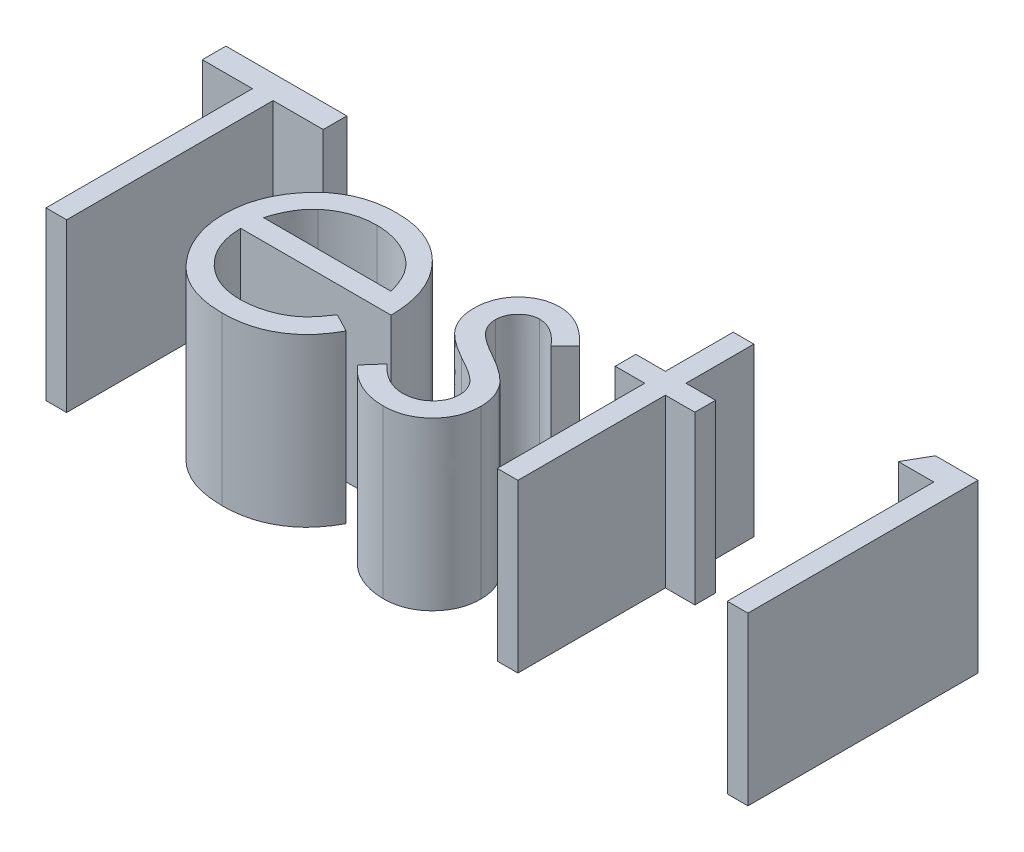
from build123d import *

# Parameters (mm, degrees)
BOSS_EXTRUDE1_DEPTH   = 2.54
BOSS_EXTRUDE1_2_DEPTH = 2.54
BOSS_EXTRUDE1_3_DEPTH = 2.54
BOSS_EXTRUDE1_4_DEPTH = 2.54
BOSS_EXTRUDE1_5_DEPTH = 2.54


with BuildPart() as part:
    # Sketch2 → Boss-Extrude1 (new body)
    with BuildSketch(Plane(origin=(0, 0, 0), x_dir=(1, 0, 0), z_dir=(0, 1, 0))):
        Polygon((-4.824988358, 3.141025641), (-4.824988358, 3.5), (-2.985244769, 3.5), (-2.985244769, 3.141025641), (-3.748065281, 3.141025641), (-3.748065281, 0), (-4.062167846, 0), (-4.062167846, 3.141025641), align=None)
    extrude(amount=BOSS_EXTRUDE1_DEPTH)


with BuildPart() as body_2:
    # Sketch2 → Boss-Extrude1 2 (new body)
    with BuildSketch(Plane(origin=(0, 0, 0), x_dir=(1, 0, 0), z_dir=(0, 1, 0))):
        with BuildLine():
            Line((-0.437368166, 0.807692308), (-0.158321692, 0.661157853))
            add(Edge.make_bspline(
                [(-0.158321692, 0.661157853), (-0.180558287, 0.621714521), (-0.223821895, 0.544973418), (-0.298222643, 0.439541558), (-0.376214716, 0.344693842), (-0.461318684, 0.262964188), (-0.550988363, 0.191712803), (-0.645721018, 0.129374978), (-0.746009835, 0.076256458), (-0.85185956, 0.03150393), (-0.964159111, -0.002905564), (-1.083180628, -0.027209785), (-1.209152123, -0.042233054), (-1.295498303, -0.043978194), (-1.339711916, -0.044871795)],
                knots=[0, 0, 0, 0, 1.120438281, 2.179929193, 3.190490725, 4.156257408, 5.095198341, 6.022838206, 6.959905092, 7.901321166, 8.864066838, 9.862729781, 10.905609505, 12, 12, 12, 12], degree=3))
            add(Edge.make_bspline(
                [(-1.339711916, -0.044871795), (-1.388853894, -0.04372462), (-1.484715655, -0.041486813), (-1.624255402, -0.022194348), (-1.755634821, 0.00927801), (-1.878846524, 0.053243552), (-1.993588777, 0.110670876), (-2.100089631, 0.180630358), (-2.198909157, 0.262762612), (-2.286933367, 0.357779056), (-2.366177249, 0.459461013), (-2.436103069, 0.565416898), (-2.4945605, 0.675380122), (-2.54211311, 0.788650646), (-2.580517975, 0.90451454), (-2.607284679, 1.024026007), (-2.622714427, 1.146861592), (-2.625078873, 1.229958927), (-2.62627041, 1.271834936)],
                knots=[0, 0, 0, 0, 1.145258523, 2.234067595, 3.276747158, 4.290159414, 5.277019952, 6.260822364, 7.254936242, 8.264827045, 9.274100331, 10.257902744, 11.220704747, 12.172965371, 13.118907548, 14.062713208, 15.023725156, 16, 16, 16, 16], degree=3))
            add(Edge.make_bspline(
                [(-2.62627041, 1.271834936), (-2.625211268, 1.311129766), (-2.62311219, 1.389006931), (-2.609881403, 1.504272476), (-2.58643311, 1.616300928), (-2.554256786, 1.725185376), (-2.512705539, 1.83074351), (-2.46187332, 1.933039574), (-2.401680942, 2.031964713), (-2.355208269, 2.094367847), (-2.331799256, 2.125801282)],
                knots=[0, 0, 0, 0, 1.024358464, 2.0301432, 3.019427413, 4.004406732, 4.986367066, 5.972626655, 6.978780325, 8, 8, 8, 8], degree=3))
            add(Edge.make_bspline(
                [(-2.331799256, 2.125801282), (-2.300091573, 2.163670152), (-2.237680626, 2.238208303), (-2.132124271, 2.336146628), (-2.017824075, 2.418190404), (-1.896212449, 2.48619754), (-1.765875975, 2.537871187), (-1.628566684, 2.576378769), (-1.482721097, 2.59795678), (-1.383015876, 2.601004614), (-1.331999576, 2.602564103)],
                knots=[0, 0, 0, 0, 1.030682036, 2.02871468, 2.997146059, 3.962720338, 4.930598197, 5.918074684, 6.934738563, 8, 8, 8, 8], degree=3))
            add(Edge.make_bspline(
                [(-1.331999576, 2.602564103), (-1.279551971, 2.601210054), (-1.176661725, 2.598553718), (-1.026629604, 2.573927385), (-0.884668887, 2.53487483), (-0.750836383, 2.47972104), (-0.625118522, 2.408561488), (-0.508332473, 2.320419647), (-0.39848096, 2.218001559), (-0.334572381, 2.13923835), (-0.30205166, 2.099158654)],
                knots=[0, 0, 0, 0, 1.056321875, 2.072262726, 3.055038591, 4.01806755, 4.982017516, 5.957941055, 6.960871419, 8, 8, 8, 8], degree=3))
            add(Edge.make_bspline(
                [(-0.30205166, 2.099158654), (-0.279924721, 2.068955072), (-0.235818128, 2.008748954), (-0.180571028, 1.910577797), (-0.132613633, 1.807867202), (-0.094280672, 1.698956905), (-0.063241171, 1.585137325), (-0.040784352, 1.46559478), (-0.027614734, 1.340364869), (-0.025026036, 1.255038314), (-0.023706307, 1.211538462)],
                knots=[0, 0, 0, 0, 0.94817472, 1.890038105, 2.849395472, 3.817997239, 4.812318967, 5.836947057, 6.897266129, 8, 8, 8, 8], degree=3))
            Line((-0.023706307, 1.211538462), (-2.312167846, 1.211538462))
            add(Edge.make_bspline(
                [(-2.312167846, 1.211538462), (-2.310628239, 1.177837997), (-2.307600665, 1.111567394), (-2.293485522, 1.01459661), (-2.271236748, 0.922223268), (-2.239967686, 0.835140226), (-2.20210084, 0.752210099), (-2.155715124, 0.674048062), (-2.10037557, 0.601010132), (-2.03864987, 0.532442994), (-1.969942775, 0.471382233), (-1.897660028, 0.416730457), (-1.820766463, 0.37092486), (-1.739868379, 0.33374497), (-1.655096594, 0.304638654), (-1.566424399, 0.284770834), (-1.474026283, 0.271463727), (-1.411040549, 0.269984061), (-1.378974737, 0.269230769)],
                knots=[0, 0, 0, 0, 1.094153842, 2.151609401, 3.174256925, 4.172055639, 5.149267565, 6.128595816, 7.11444997, 8.118368179, 9.117203808, 10.09244225, 11.054858984, 12.015122123, 12.976791628, 13.957293641, 14.960065497, 16, 16, 16, 16], degree=3))
            add(Edge.make_bspline(
                [(-1.378974737, 0.269230769), (-1.347623589, 0.269838826), (-1.285416898, 0.271045327), (-1.192776041, 0.282777238), (-1.101636513, 0.301747513), (-1.01237553, 0.327637504), (-0.926804684, 0.359214356), (-0.847559134, 0.397317213), (-0.774678918, 0.43946696), (-0.706561952, 0.487676635), (-0.640490958, 0.546684822), (-0.574948472, 0.620320543), (-0.504671819, 0.707408071), (-0.460682226, 0.772953737), (-0.437368166, 0.807692308)],
                knots=[0, 0, 0, 0, 0.99110716, 1.966546729, 2.947904876, 3.932708344, 4.903319531, 5.828989031, 6.710028674, 7.56322171, 8.463672341, 9.504779593, 10.677557249, 12, 12, 12, 12], degree=3))
        make_face()
        with BuildLine():
            add(Edge.make_bspline(
                [(-0.337808871, 1.525641026), (-0.349305496, 1.567303899), (-0.371432797, 1.64749152), (-0.417669162, 1.75853241), (-0.469740702, 1.857220311), (-0.531362434, 1.942799944), (-0.601181159, 2.018803457), (-0.681826342, 2.085222043), (-0.772262235, 2.144639494), (-0.872021376, 2.194791993), (-0.977663161, 2.237481852), (-1.088269353, 2.266106968), (-1.201127141, 2.28571651), (-1.277461427, 2.287542618), (-1.315873775, 2.288461538)],
                knots=[0, 0, 0, 0, 1.154881502, 2.222775134, 3.210006277, 4.132804581, 5.035138423, 5.962687519, 6.919655026, 7.923214229, 8.944639381, 9.960483929, 10.97369054, 12, 12, 12, 12], degree=3))
            add(Edge.make_bspline(
                [(-1.315873775, 2.288461538), (-1.347223214, 2.287849867), (-1.409194463, 2.286640721), (-1.500495531, 2.275170592), (-1.58817523, 2.256210747), (-1.672880517, 2.23024579), (-1.753501386, 2.195637188), (-1.831696154, 2.155053961), (-1.90547655, 2.105512377), (-1.951617846, 2.067753522), (-1.974928262, 2.048677885)],
                knots=[0, 0, 0, 0, 1.04873581, 2.073130211, 3.073294108, 4.04793562, 5.032784715, 6.005352987, 6.992311501, 8, 8, 8, 8], degree=3))
            add(Edge.make_bspline(
                [(-1.974928262, 2.048677885), (-1.991621544, 2.033583569), (-2.025404678, 2.003036353), (-2.0705452, 1.950407146), (-2.113765673, 1.893655584), (-2.153099325, 1.83061046), (-2.189176912, 1.761989681), (-2.222936889, 1.688372045), (-2.253323301, 1.609198915), (-2.270419411, 1.554026476), (-2.279215121, 1.525641026)],
                knots=[0, 0, 0, 0, 0.879870761, 1.780643979, 2.707998968, 3.669668524, 4.684282772, 5.740141944, 6.837334558, 8, 8, 8, 8], degree=3))
            Line((-2.279215121, 1.525641026), (-0.337808871, 1.525641026))
        make_face(mode=Mode.SUBTRACT)
    extrude(amount=BOSS_EXTRUDE1_2_DEPTH)


with BuildPart() as body_3:
    # Sketch2 → Boss-Extrude1 3 (new body)
    with BuildSketch(Plane(origin=(0, 0, 0), x_dir=(1, 0, 0), z_dir=(0, 1, 0))):
        with BuildLine():
            Line((1.816037283, 2.238681891), (1.602896257, 2.019230769))
            add(Edge.make_bspline(
                [(1.602896257, 2.019230769), (1.584505754, 2.040543916), (1.549051028, 2.081633153), (1.492819547, 2.136570219), (1.436795943, 2.182707158), (1.38174713, 2.221659417), (1.32628886, 2.251108564), (1.271071942, 2.272603426), (1.216039204, 2.285905231), (1.179253169, 2.28761967), (1.161189526, 2.288461538)],
                knots=[0, 0, 0, 0, 1.26578478, 2.440284043, 3.530471711, 4.527705817, 5.468200915, 6.346673037, 7.188140097, 8, 8, 8, 8], degree=3))
            add(Edge.make_bspline(
                [(1.161189526, 2.288461538), (1.139050136, 2.287386665), (1.09548295, 2.285271468), (1.033057132, 2.264158037), (0.975106507, 2.231749299), (0.924949527, 2.185780715), (0.882461847, 2.133016446), (0.851448166, 2.074020122), (0.832482182, 2.010572078), (0.83007745, 1.96654222), (0.828857796, 1.944210737)],
                knots=[0, 0, 0, 0, 0.99966794, 1.967205029, 2.953328237, 3.988086729, 5.028030931, 6.008226631, 6.989793394, 8, 8, 8, 8], degree=3))
            add(Edge.make_bspline(
                [(0.828857796, 1.944210737), (0.829968608, 1.923998693), (0.832187101, 1.883631582), (0.84943378, 1.824083548), (0.876899852, 1.76602651), (0.902570047, 1.730463604), (0.915796898, 1.712139423)],
                knots=[0, 0, 0, 0, 0.960159726, 1.917612774, 2.927026955, 4, 4, 4, 4], degree=3))
            add(Edge.make_bspline(
                [(0.915796898, 1.712139423), (0.923760392, 1.702354839), (0.940709685, 1.681529584), (0.9725182, 1.652625731), (1.008540702, 1.62068348), (1.05186064, 1.588746643), (1.100611668, 1.555114918), (1.155850952, 1.521112785), (1.215825457, 1.48414836), (1.258762764, 1.460703924), (1.281081353, 1.448517628)],
                knots=[0, 0, 0, 0, 0.66740084, 1.420478572, 2.27185888, 3.217733974, 4.268547843, 5.408967954, 6.65319498, 8, 8, 8, 8], degree=3))
            add(Edge.make_bspline(
                [(1.281081353, 1.448517628), (1.30829493, 1.433272725), (1.3608626, 1.403824593), (1.435555368, 1.358114889), (1.503342409, 1.312683465), (1.564798076, 1.268016191), (1.618739885, 1.222863324), (1.666804438, 1.178955567), (1.707792882, 1.134966258), (1.730746808, 1.104233145), (1.741718372, 1.089543269)],
                knots=[0, 0, 0, 0, 1.27191281, 2.456916733, 3.569705269, 4.599008579, 5.553216877, 6.436649441, 7.252746552, 8, 8, 8, 8], degree=3))
            add(Edge.make_bspline(
                [(1.741718372, 1.089543269), (1.7599289, 1.059877181), (1.796171229, 1.00083616), (1.834229496, 0.903617733), (1.85628977, 0.80050723), (1.859351991, 0.72997501), (1.860909078, 0.694110577)],
                knots=[0, 0, 0, 0, 0.995354457, 1.980940102, 2.973342416, 4, 4, 4, 4], degree=3))
            add(Edge.make_bspline(
                [(1.860909078, 0.694110577), (1.860189544, 0.668841431), (1.858771624, 0.619045818), (1.848913557, 0.545710988), (1.83195858, 0.47557643), (1.808864827, 0.407881146), (1.777680454, 0.343922206), (1.741132656, 0.282085957), (1.697257745, 0.223710026), (1.647166369, 0.168871066), (1.592320875, 0.118785319), (1.533814737, 0.074761365), (1.471575906, 0.038187028), (1.406049105, 0.007921682), (1.337085451, -0.016146576), (1.264674161, -0.032809107), (1.189045407, -0.042781868), (1.137615599, -0.044166344), (1.111409879, -0.044871795)],
                knots=[0, 0, 0, 0, 1.032770009, 2.035186124, 3.017557409, 3.978232242, 4.952395191, 5.920591857, 6.910227898, 7.931268572, 8.952309245, 9.941945286, 10.918353717, 11.897095711, 12.887975737, 13.898235213, 14.929059601, 16, 16, 16, 16], degree=3))
            add(Edge.make_bspline(
                [(1.111409879, -0.044871795), (1.076042703, -0.043879095), (1.005799776, -0.041907487), (0.901910057, -0.023401426), (0.800389299, 0.005393968), (0.702005758, 0.045109902), (0.608959644, 0.095260615), (0.52382872, 0.155323008), (0.446317257, 0.223313006), (0.402198984, 0.275425916), (0.380139847, 0.301482372)],
                knots=[0, 0, 0, 0, 1.013940152, 2.01379169, 3.017749504, 4.037548394, 5.051665909, 6.043208538, 7.021604269, 8, 8, 8, 8], degree=3))
            Line((0.380139847, 0.301482372), (0.58837302, 0.538461538))
            add(Edge.make_bspline(
                [(0.58837302, 0.538461538), (0.608145433, 0.517106774), (0.646477245, 0.475707334), (0.707778462, 0.420582993), (0.770157863, 0.374381722), (0.83299255, 0.335738307), (0.897212644, 0.305962904), (0.962458258, 0.28504431), (1.028596682, 0.271600118), (1.073018818, 0.270021836), (1.095284078, 0.269230769)],
                knots=[0, 0, 0, 0, 1.179806542, 2.287233372, 3.337373186, 4.324005949, 5.273901747, 6.200048787, 7.097828587, 8, 8, 8, 8], degree=3))
            add(Edge.make_bspline(
                [(1.095284078, 0.269230769), (1.125602004, 0.270601594), (1.184838145, 0.273279956), (1.269681904, 0.297597048), (1.34802053, 0.335727), (1.416043876, 0.389811698), (1.473946037, 0.452767271), (1.515874211, 0.52368139), (1.542150387, 0.600472847), (1.545236385, 0.653705149), (1.546806513, 0.680789263)],
                knots=[0, 0, 0, 0, 1.072336372, 2.095165389, 3.102688358, 4.141489647, 5.156069229, 6.117746104, 7.042326257, 8, 8, 8, 8], degree=3))
            add(Edge.make_bspline(
                [(1.546806513, 0.680789263), (1.545720219, 0.703098881), (1.543575476, 0.747146237), (1.526732204, 0.810896578), (1.500119352, 0.871365859), (1.473914704, 0.906755506), (1.460568533, 0.924779647)],
                knots=[0, 0, 0, 0, 1.013901739, 2.00181326, 2.98231254, 4, 4, 4, 4], degree=3))
            add(Edge.make_bspline(
                [(1.460568533, 0.924779647), (1.452546138, 0.93381501), (1.435070466, 0.953497292), (1.403015225, 0.98192237), (1.364633362, 1.01256047), (1.319493199, 1.044892059), (1.267503737, 1.078490664), (1.208454262, 1.113180016), (1.14315371, 1.150607742), (1.096983078, 1.175427397), (1.07284818, 1.188401442)],
                knots=[0, 0, 0, 0, 0.615000592, 1.339693406, 2.178160186, 3.116406724, 4.166410947, 5.330106347, 6.604359322, 8, 8, 8, 8], degree=3))
            add(Edge.make_bspline(
                [(1.07284818, 1.188401442), (1.04680154, 1.202940574), (0.996288793, 1.23113659), (0.924741502, 1.275052671), (0.860194147, 1.319719945), (0.801093573, 1.362632784), (0.748932567, 1.406053728), (0.703916619, 1.45003098), (0.664273403, 1.492790966), (0.642325991, 1.523088263), (0.631842571, 1.537560096)],
                knots=[0, 0, 0, 0, 1.262093308, 2.447601706, 3.550203992, 4.582594899, 5.537233252, 6.418365656, 7.244515135, 8, 8, 8, 8], degree=3))
            add(Edge.make_bspline(
                [(0.631842571, 1.537560096), (0.613711971, 1.566705711), (0.577444436, 1.625007126), (0.542229245, 1.722317603), (0.518023216, 1.824762661), (0.515860826, 1.895449515), (0.514755231, 1.931590545)],
                knots=[0, 0, 0, 0, 0.985009483, 1.970363186, 2.962279964, 4, 4, 4, 4], degree=3))
            add(Edge.make_bspline(
                [(0.514755231, 1.931590545), (0.515289427, 1.955215943), (0.516334923, 2.001454194), (0.524678974, 2.069393014), (0.539870685, 2.133941168), (0.558925608, 2.196068031), (0.585408612, 2.254570125), (0.617054518, 2.310227596), (0.654241943, 2.362963514), (0.697085233, 2.411966646), (0.744191879, 2.456475972), (0.795086648, 2.4952746), (0.848624905, 2.528380955), (0.905033325, 2.556146116), (0.964853797, 2.577147498), (1.027668184, 2.591604883), (1.093349339, 2.601260086), (1.138250465, 2.602123171), (1.161189526, 2.602564103)],
                knots=[0, 0, 0, 0, 1.087655834, 2.128696564, 3.144119009, 4.137814668, 5.115653402, 6.093965665, 7.082169637, 8.081268856, 9.086088321, 10.061021666, 11.022561449, 11.980240094, 12.950172527, 13.934149372, 14.944599409, 16, 16, 16, 16], degree=3))
            add(Edge.make_bspline(
                [(1.161189526, 2.602564103), (1.18838159, 2.601459762), (1.243275812, 2.599230364), (1.325630438, 2.581524674), (1.40786378, 2.552391569), (1.49018713, 2.512155336), (1.571997419, 2.46008846), (1.654014276, 2.397159161), (1.737222306, 2.323781446), (1.789178619, 2.267682221), (1.816037283, 2.238681891)],
                knots=[0, 0, 0, 0, 0.845714091, 1.707292901, 2.609013841, 3.555613372, 4.552488639, 5.621697636, 6.770543573, 8, 8, 8, 8], degree=3))
        make_face()
    extrude(amount=BOSS_EXTRUDE1_3_DEPTH)


with BuildPart() as body_4:
    # Sketch2 → Boss-Extrude1 4 (new body)
    with BuildSketch(Plane(origin=(0, 0, 0), x_dir=(1, 0, 0), z_dir=(0, 1, 0))):
        Polygon((2.80321677, 3.58974359), (3.117319334, 3.58974359), (3.117319334, 2.557692308), (3.566037283, 2.557692308), (3.566037283, 2.243589744), (3.117319334, 2.243589744), (3.117319334, 0), (2.80321677, 0), (2.80321677, 2.243589744), (2.354498821, 2.243589744), (2.354498821, 2.557692308), (2.80321677, 2.557692308), align=None)
    extrude(amount=BOSS_EXTRUDE1_4_DEPTH)


with BuildPart() as body_5:
    # Sketch2 → Boss-Extrude1 5 (new body)
    with BuildSketch(Plane(origin=(0, 0, 0), x_dir=(1, 0, 0), z_dir=(0, 1, 0))):
        Polygon((5.970183917, 3.5), (6.617319334, 3.5), (6.617319334, 0), (6.30321677, 0), (6.30321677, 3.141025641), (5.764755231, 3.141025641), align=None)
    extrude(amount=BOSS_EXTRUDE1_5_DEPTH)


solid = Compound([part.part, body_2.part, body_3.part, body_4.part, body_5.part])
